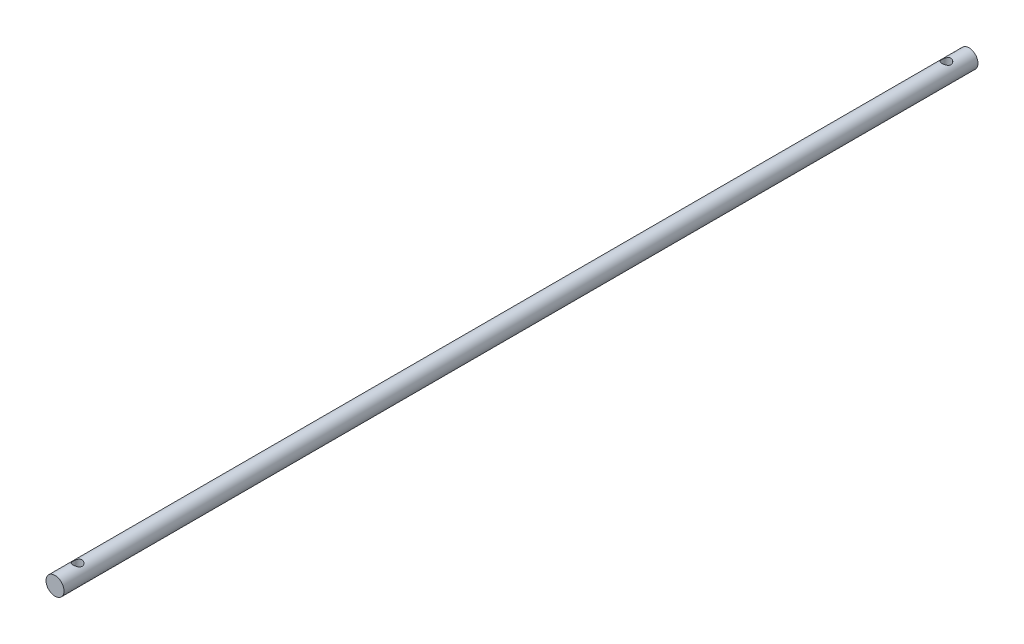
from build123d import *

# Parameters (mm, degrees)
SKETCH1_R                         = 4
EXTRUDE1_DEPTH                    = 405
SKETCH3_W                         = 2
SKETCH3_H                         = 4
F_4_0_4_DIAMETER_HOLE1_AT_2_COUNT = 2
F_4_0_4_DIAMETER_HOLE1_AT_2_PITCH = 385


with BuildPart() as part:
    # Sketch1 → Extrude1 (new body)
    with BuildSketch(Plane.XY):
        Circle(SKETCH1_R)
    extrude(amount=EXTRUDE1_DEPTH)

    # Sketch3 → Ø4.0 (4) Diameter Hole1 (revolve, cut)
    with BuildSketch(Plane(origin=(0, 0, 10), x_dir=(0, 0, -1), z_dir=(1, 0, 0))):
        with Locations((1, 2)):
            Rectangle(SKETCH3_W, SKETCH3_H)
    f_4_0_4_diameter_hole1 = revolve(axis=Axis((0, -6.35, 10), (0, 1, 0)), mode=Mode.SUBTRACT)

    # Ø4.0 (4) Diameter Hole1 at 2: Ø4.0 (4) Diameter Hole1 ×2
    with Locations(*[(0, 0, i * F_4_0_4_DIAMETER_HOLE1_AT_2_PITCH) for i in range(1, F_4_0_4_DIAMETER_HOLE1_AT_2_COUNT)]):
        add(f_4_0_4_diameter_hole1, mode=Mode.SUBTRACT)


solid = part.part
